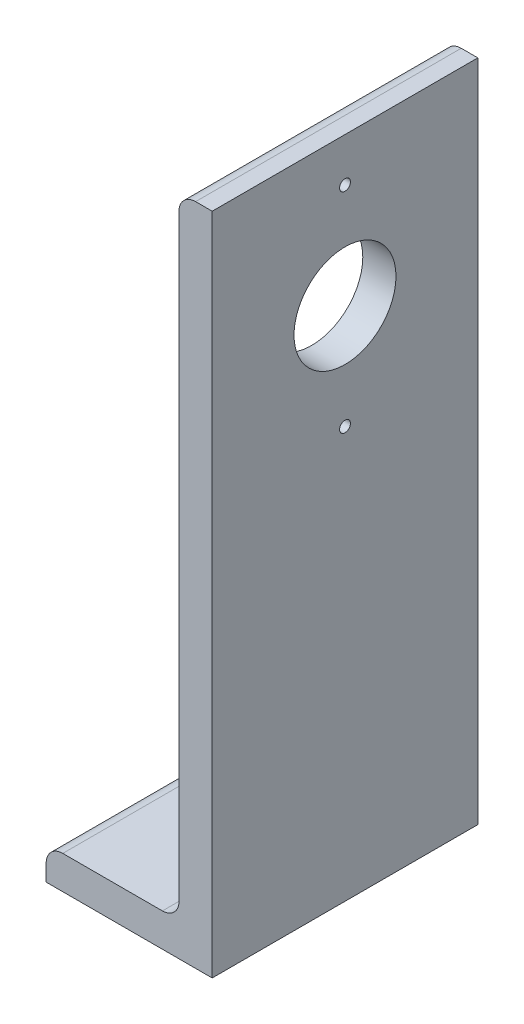
from build123d import *

# Parameters (mm, degrees)
BOSS_EXTRUDE1_DEPTH = 25.4
SKETCH3_R           = 4.765
CUT_EXTRUDE1_DEPTH  = 131.484388434
SKETCH4_R           = 9.75
CUT_EXTRUDE2_DEPTH  = 12.7
SKETCH5_R           = 1.04
CUT_EXTRUDE3_DEPTH  = 10


with BuildPart() as part:
    # Sketch2 → Boss-Extrude1 (new, symmetric)
    with BuildSketch(Plane.XY):
        with BuildLine():
            Line((-15.875, 0), (15.875, 0))
            Line((15.875, 0), (15.875, 127))
            Line((15.875, 127), (12.7, 127))
            ThreePointArc((12.7, 127), (10.45493597, 126.07006403), (9.525, 123.825))
            Line((9.525, 123.825), (9.525, 9.525))
            ThreePointArc((9.525, 9.525), (8.59506403, 7.27993597), (6.35, 6.35))
            Line((6.35, 6.35), (-12.7, 6.35))
            ThreePointArc((-12.7, 6.35), (-14.94506403, 5.42006403), (-15.875, 3.175))
            Line((-15.875, 3.175), (-15.875, 0))
        make_face()
    extrude(amount=BOSS_EXTRUDE1_DEPTH, both=True)

    # Sketch3 → Cut-Extrude1 (cut, through all)
    with BuildSketch(Plane.XZ):
        with Locations((-4.826, 0)):
            Circle(SKETCH3_R)
    extrude(amount=-CUT_EXTRUDE1_DEPTH, mode=Mode.SUBTRACT)

    # Sketch4 → Cut-Extrude2 (cut)
    with BuildSketch(Plane(origin=(15.875, 0, 0), x_dir=(0, 0, -1), z_dir=(1, 0, 0))):
        with Locations((0, 98.65)):
            Circle(SKETCH4_R)
    extrude(amount=-CUT_EXTRUDE2_DEPTH, mode=Mode.SUBTRACT)

    # Sketch5 → Cut-Extrude3 (cut)
    with BuildSketch(Plane(origin=(15.875, 0, 0), x_dir=(0, 0, -1), z_dir=(1, 0, 0))):
        with Locations((0, 78.65)):
            Circle(SKETCH5_R)
        with Locations((0, 118.65)):
            Circle(SKETCH5_R)
    extrude(amount=-CUT_EXTRUDE3_DEPTH, mode=Mode.SUBTRACT)


solid = part.part
